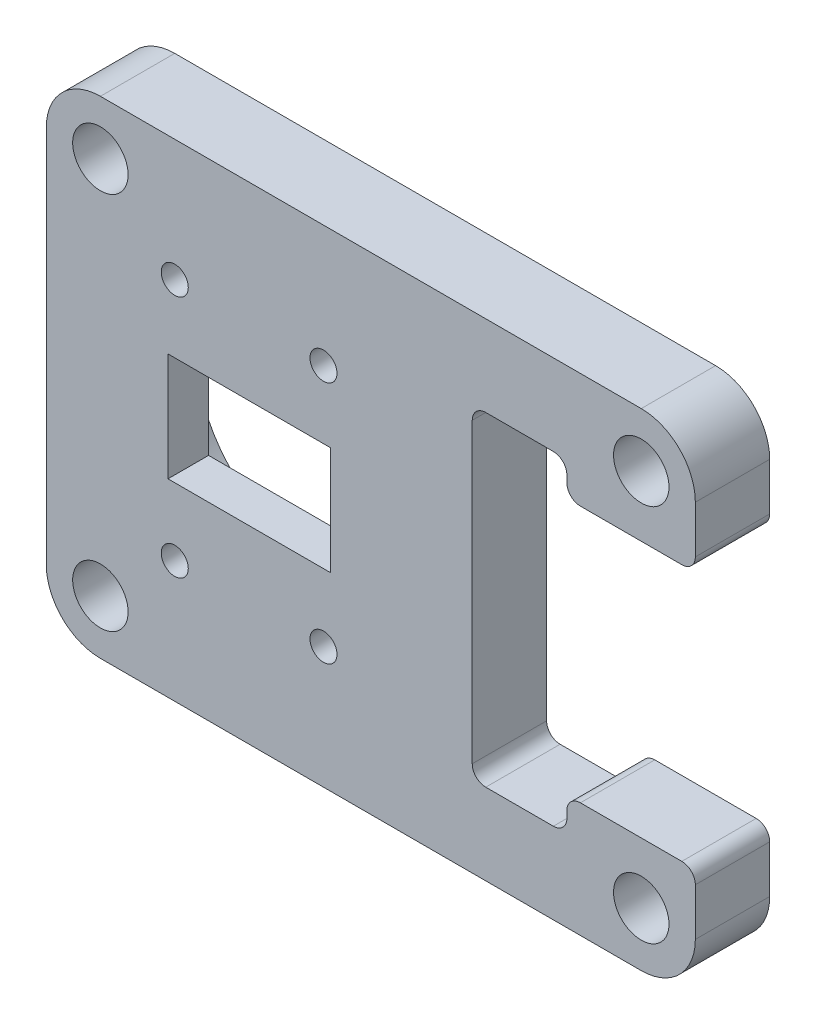
from build123d import *

# Parameters (mm, degrees)
SKETCH1_R           = 2.05
BOSS_EXTRUDE1_DEPTH = 2.75
SKETCH2_R           = 9.5
CUT_EXTRUDE1_DEPTH  = 2.5
SKETCH3_W           = 12
SKETCH3_H           = 8
CUT_EXTRUDE2_DEPTH  = 31.149626863
SKETCH4_R           = 1
CUT_EXTRUDE3_DEPTH  = 31.5
SKETCH5_W           = 7
SKETCH5_H           = 24
CUT_EXTRUDE4_DEPTH  = 31.5
SKETCH6_W           = 25
SKETCH6_H           = 19
CUT_EXTRUDE5_DEPTH  = 31.5
FILLET1_R           = 1


with BuildPart() as part:
    # Sketch1 → Boss-Extrude1 (new, symmetric)
    with BuildSketch(Plane.XY):
        with BuildLine():
            Line((-20, -18), (20, -18))
            ThreePointArc((20, -18), (22.828427125, -16.828427125), (24, -14))
            Line((24, -14), (24, 14))
            ThreePointArc((24, 14), (22.828427125, 16.828427125), (20, 18))
            Line((20, 18), (-20, 18))
            ThreePointArc((-20, 18), (-22.828427125, 16.828427125), (-24, 14))
            Line((-24, 14), (-24, -14))
            ThreePointArc((-24, -14), (-22.828427125, -16.828427125), (-20, -18))
        make_face()
        with Locations((-20, -14)):
            Circle(SKETCH1_R, mode=Mode.SUBTRACT)
        with Locations((-20, 14)):
            Circle(SKETCH1_R, mode=Mode.SUBTRACT)
        with Locations((20, 14)):
            Circle(SKETCH1_R, mode=Mode.SUBTRACT)
        with Locations((20, -14)):
            Circle(SKETCH1_R, mode=Mode.SUBTRACT)
    extrude(amount=BOSS_EXTRUDE1_DEPTH, both=True)

    # Sketch2 → Cut-Extrude1 (cut)
    with BuildSketch(Plane.XY.offset(-2.75)):
        with Locations((-9, 0)):
            Circle(SKETCH2_R)
    extrude(amount=CUT_EXTRUDE1_DEPTH, mode=Mode.SUBTRACT)

    # Sketch3 → Cut-Extrude2 (cut, through all)
    with BuildSketch(Plane(origin=(0, 0, -0.25), x_dir=(1, 0, 0), z_dir=(0, 0, -1))):
        with Locations((-9, 0)):
            Rectangle(SKETCH3_W, SKETCH3_H)
    extrude(amount=-CUT_EXTRUDE2_DEPTH, mode=Mode.SUBTRACT)

    # Sketch4 → Cut-Extrude3 (cut, through all)
    with BuildSketch(Plane.XY.offset(2.75)):
        with Locations((-14.5, 9)):
            Circle(SKETCH4_R)
        with Locations((-3.5, 9)):
            Circle(SKETCH4_R)
        with Locations((-3.5, -9)):
            Circle(SKETCH4_R)
        with Locations((-14.5, -9)):
            Circle(SKETCH4_R)
    extrude(amount=-CUT_EXTRUDE3_DEPTH, mode=Mode.SUBTRACT)

    # Sketch5 → Cut-Extrude4 (cut, through all)
    with BuildSketch(Plane.XY.offset(2.75)):
        with Locations((11, 0)):
            Rectangle(SKETCH5_W, SKETCH5_H)
    extrude(amount=-CUT_EXTRUDE4_DEPTH, mode=Mode.SUBTRACT)

    # Sketch6 → Cut-Extrude5 (cut, through all)
    with BuildSketch(Plane(origin=(0, 0, -2.75), x_dir=(-1, 0, 0), z_dir=(0, 0, -1))):
        with Locations((-24, 0)):
            Rectangle(SKETCH6_W, SKETCH6_H)
    extrude(amount=-CUT_EXTRUDE5_DEPTH, mode=Mode.SUBTRACT)

    # Fillet1
    fillet1_edges = [part.edges().sort_by_distance(p)[0] for p in [
        (14.5, -12, 0),
        (7.5, -12, 0),
        (7.5, 12, 0),
        (14.5, 12, 0),
        (14.5, 9.5, 0),
        (24, 9.5, 0),
        (24, -9.5, 0),
        (14.5, -9.5, 0),
    ]]
    fillet(fillet1_edges, radius=FILLET1_R)


solid = part.part
